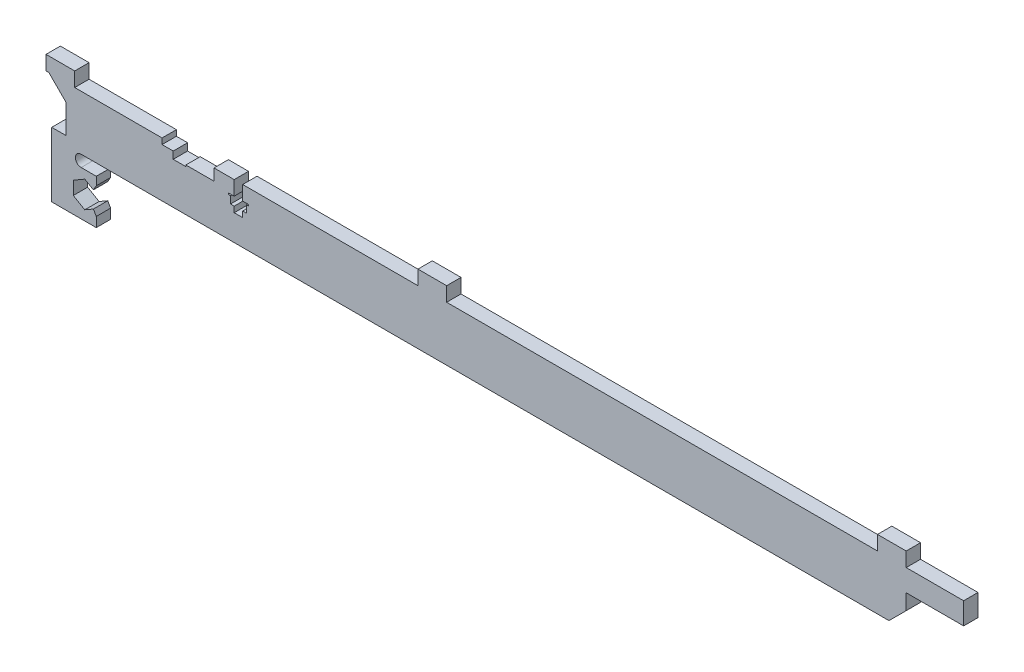
from build123d import *

# Parameters (mm, degrees)
BOSS_EXTRUDE1_DEPTH = 5
CHAMFER1_SIZE       = 6


with BuildPart() as part:
    # Sketch1 → Boss-Extrude1 (new body)
    with BuildSketch(Plane.XY):
        with BuildLine():
            Line((-250.8, 3.6), (-241, 3.6))
            Line((-241, 3.6), (-241, 7.6))
            Line((-241, 7.6), (-233.98, 7.6))
            Line((-233.98, 7.6), (-233.98, 2.6))
            Line((-233.98, 2.6), (-236, 2.6))
            Line((-236, 2.6), (-236, 2.1))
            Line((-236, 2.1), (-235.25, 2.1))
            Line((-235.25, 2.1), (-235.25, -0.4))
            Line((-235.25, -0.4), (-233.98, -0.4))
            Line((-233.98, -0.4), (-233.98, -2.4))
            Line((-233.98, -2.4), (-231.02, -2.4))
            Line((-231.02, -2.4), (-231.02, -0.4))
            Line((-231.02, -0.4), (-229.75, -0.4))
            Line((-229.75, -0.4), (-229.75, 2.1))
            Line((-229.75, 2.1), (-229, 2.1))
            Line((-229, 2.1), (-229, 2.6))
            Line((-229, 2.6), (-231.02, 2.6))
            Line((-231.02, 2.6), (-231.02, 7.6))
            Line((-231.02, 7.6), (-170, 7.6))
            Line((-170, 7.6), (-170, 12.6))
            Line((-170, 12.6), (-160, 12.6))
            Line((-160, 12.6), (-160, 7.6))
            Line((-160, 7.6), (-10, 7.6))
            Line((-10, 7.6), (-10, 12.6))
            Line((-10, 12.6), (0, 12.6))
            Line((0, 12.6), (0, 7.6))
            Line((0, 7.6), (20, 7.6))
            Line((20, 7.6), (20, 0))
            Line((20, 0), (0, 0))
            Line((0, 0), (0, -11.4))
            Line((0, -11.4), (-287.270831989, -11.4))
            ThreePointArc((-287.270831989, -11.4), (-289.270831989, -13.4), (-287.270831989, -15.4))
            Line((-287.270831989, -15.4), (-282, -15.4))
            Line((-282, -15.4), (-282, -18.281197846))
            Line((-282, -18.281197846), (-283, -20.013248654))
            Line((-283, -20.013248654), (-286, -18.281197846))
            Line((-286, -18.281197846), (-290, -20.590598923))
            Line((-290, -20.590598923), (-290, -25.209401077))
            Line((-290, -25.209401077), (-286, -27.518802154))
            Line((-286, -27.518802154), (-283, -25.786751346))
            Line((-283, -25.786751346), (-282, -27.518802154))
            Line((-282, -27.518802154), (-282, -30.9))
            Line((-282, -30.9), (-297.5, -30.9))
            Line((-297.5, -30.9), (-297.5, -8.4))
            Line((-297.5, -8.4), (-292.5, -8.4))
            Line((-292.5, -8.4), (-292.5, 1.6))
            Line((-292.5, 1.6), (-298.5, 7.6))
            Line((-298.5, 7.6), (-299.5, 7.6))
            Line((-299.5, 7.6), (-299.5, 12.6))
            Line((-299.5, 12.6), (-289.5, 12.6))
            Line((-289.5, 12.6), (-289.5, 7.6))
            Line((-289.5, 7.6), (-259.093151184, 7.6))
            Line((-259.093151184, 7.6), (-259.093151184, 5.6))
            Line((-259.093151184, 5.6), (-255.2, 5.6))
            Line((-255.2, 5.6), (-255.2, 3.1))
            Line((-255.2, 3.1), (-250.8, 3.1))
            Line((-250.8, 3.1), (-250.8, 3.6))
        make_face()
    extrude(amount=BOSS_EXTRUDE1_DEPTH)

    # Chamfer1
    chamfer1_edges = [part.edges().sort_by_distance(p)[0] for p in [
        (0, -11.4, 2.5),
    ]]
    chamfer(chamfer1_edges, length=CHAMFER1_SIZE)


solid = part.part
